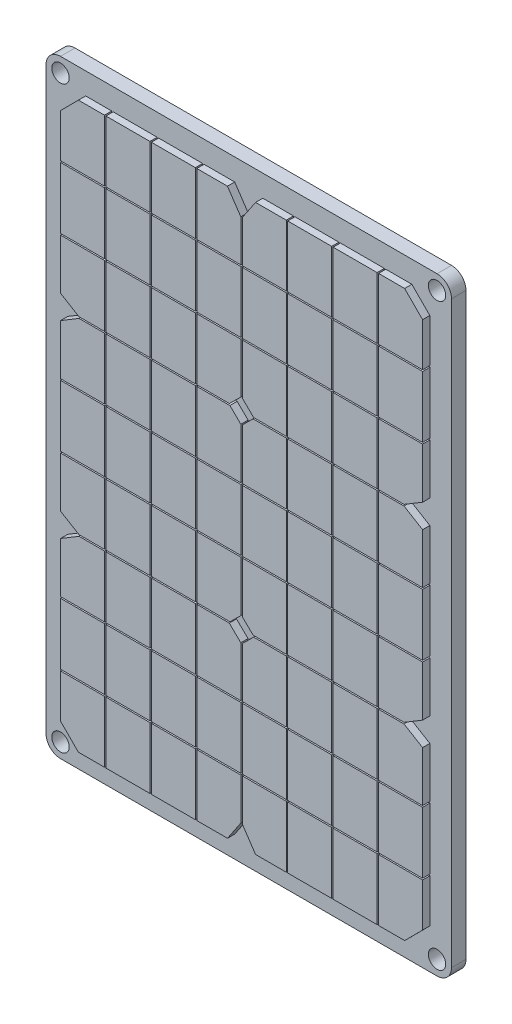
from build123d import *

# Parameters (mm, degrees)
SKETCH1_W                  = 280
SKETCH1_H                  = 420
BOSS_EXTRUDE1_DEPTH        = 10
SKETCH3_W                  = 30.375
SKETCH3_H                  = 42.44
BOSS_EXTRUDE2_DEPTH        = 5
LPATTERN1_COUNT            = 8
LPATTERN1_PITCH            = 31.38
LPATTERN2_COPY_1_SKETCH_W  = 30.375
LPATTERN2_COPY_1_SKETCH_H  = 42.44
LPATTERN2_COPY_1_DEPTH     = 5
LPATTERN2_COPY_2_SKETCH_W  = 30.375
LPATTERN2_COPY_2_SKETCH_H  = 42.44
LPATTERN2_COPY_2_DEPTH     = 5
LPATTERN2_COPY_3_SKETCH_W  = 30.375
LPATTERN2_COPY_3_SKETCH_H  = 42.44
LPATTERN2_COPY_3_DEPTH     = 5
LPATTERN2_COPY_4_SKETCH_W  = 30.375
LPATTERN2_COPY_4_SKETCH_H  = 42.44
LPATTERN2_COPY_4_DEPTH     = 5
LPATTERN2_COPY_5_SKETCH_W  = 30.375
LPATTERN2_COPY_5_SKETCH_H  = 42.44
LPATTERN2_COPY_5_DEPTH     = 5
LPATTERN2_COPY_6_SKETCH_W  = 30.375
LPATTERN2_COPY_6_SKETCH_H  = 42.44
LPATTERN2_COPY_6_DEPTH     = 5
LPATTERN2_COPY_7_SKETCH_W  = 30.375
LPATTERN2_COPY_7_SKETCH_H  = 42.44
LPATTERN2_COPY_7_DEPTH     = 5
LPATTERN2_COPY_8_SKETCH_W  = 30.375
LPATTERN2_COPY_8_SKETCH_H  = 42.44
LPATTERN2_COPY_8_DEPTH     = 5
LPATTERN2_COPY_9_SKETCH_W  = 30.375
LPATTERN2_COPY_9_SKETCH_H  = 42.44
LPATTERN2_COPY_9_DEPTH     = 5
LPATTERN2_COPY_10_SKETCH_W = 30.375
LPATTERN2_COPY_10_SKETCH_H = 42.44
LPATTERN2_COPY_10_DEPTH    = 5
LPATTERN2_COPY_11_SKETCH_W = 30.375
LPATTERN2_COPY_11_SKETCH_H = 42.44
LPATTERN2_COPY_11_DEPTH    = 5
LPATTERN2_COPY_12_SKETCH_W = 30.375
LPATTERN2_COPY_12_SKETCH_H = 42.44
LPATTERN2_COPY_12_DEPTH    = 5
LPATTERN2_COPY_13_SKETCH_W = 30.375
LPATTERN2_COPY_13_SKETCH_H = 42.44
LPATTERN2_COPY_13_DEPTH    = 5
LPATTERN2_COPY_14_SKETCH_W = 30.375
LPATTERN2_COPY_14_SKETCH_H = 42.44
LPATTERN2_COPY_14_DEPTH    = 5
LPATTERN2_COPY_15_SKETCH_W = 30.375
LPATTERN2_COPY_15_SKETCH_H = 42.44
LPATTERN2_COPY_15_DEPTH    = 5
LPATTERN2_COPY_16_SKETCH_W = 30.375
LPATTERN2_COPY_16_SKETCH_H = 42.44
LPATTERN2_COPY_16_DEPTH    = 5
LPATTERN2_COPY_17_SKETCH_W = 30.375
LPATTERN2_COPY_17_SKETCH_H = 42.44
LPATTERN2_COPY_17_DEPTH    = 5
LPATTERN2_COPY_18_SKETCH_W = 30.375
LPATTERN2_COPY_18_SKETCH_H = 42.44
LPATTERN2_COPY_18_DEPTH    = 5
LPATTERN2_COPY_19_SKETCH_W = 30.375
LPATTERN2_COPY_19_SKETCH_H = 42.44
LPATTERN2_COPY_19_DEPTH    = 5
LPATTERN2_COPY_20_SKETCH_W = 30.375
LPATTERN2_COPY_20_SKETCH_H = 42.44
LPATTERN2_COPY_20_DEPTH    = 5
LPATTERN2_COPY_21_SKETCH_W = 30.375
LPATTERN2_COPY_21_SKETCH_H = 42.44
LPATTERN2_COPY_21_DEPTH    = 5
LPATTERN2_COPY_22_SKETCH_W = 30.375
LPATTERN2_COPY_22_SKETCH_H = 42.44
LPATTERN2_COPY_22_DEPTH    = 5
LPATTERN2_COPY_23_SKETCH_W = 30.375
LPATTERN2_COPY_23_SKETCH_H = 42.44
LPATTERN2_COPY_23_DEPTH    = 5
LPATTERN2_COPY_24_SKETCH_W = 30.375
LPATTERN2_COPY_24_SKETCH_H = 42.44
LPATTERN2_COPY_24_DEPTH    = 5
LPATTERN2_COPY_25_SKETCH_W = 30.375
LPATTERN2_COPY_25_SKETCH_H = 42.44
LPATTERN2_COPY_25_DEPTH    = 5
LPATTERN2_COPY_26_SKETCH_W = 30.375
LPATTERN2_COPY_26_SKETCH_H = 42.44
LPATTERN2_COPY_26_DEPTH    = 5
LPATTERN2_COPY_27_SKETCH_W = 30.375
LPATTERN2_COPY_27_SKETCH_H = 42.44
LPATTERN2_COPY_27_DEPTH    = 5
LPATTERN2_COPY_28_SKETCH_W = 30.375
LPATTERN2_COPY_28_SKETCH_H = 42.44
LPATTERN2_COPY_28_DEPTH    = 5
LPATTERN2_COPY_29_SKETCH_W = 30.375
LPATTERN2_COPY_29_SKETCH_H = 42.44
LPATTERN2_COPY_29_DEPTH    = 5
LPATTERN2_COPY_30_SKETCH_W = 30.375
LPATTERN2_COPY_30_SKETCH_H = 42.44
LPATTERN2_COPY_30_DEPTH    = 5
LPATTERN2_COPY_31_SKETCH_W = 30.375
LPATTERN2_COPY_31_SKETCH_H = 42.44
LPATTERN2_COPY_31_DEPTH    = 5
LPATTERN2_COPY_32_SKETCH_W = 30.375
LPATTERN2_COPY_32_SKETCH_H = 42.44
LPATTERN2_COPY_32_DEPTH    = 5
LPATTERN2_COPY_33_SKETCH_W = 30.375
LPATTERN2_COPY_33_SKETCH_H = 42.44
LPATTERN2_COPY_33_DEPTH    = 5
LPATTERN2_COPY_34_SKETCH_W = 30.375
LPATTERN2_COPY_34_SKETCH_H = 42.44
LPATTERN2_COPY_34_DEPTH    = 5
LPATTERN2_COPY_35_SKETCH_W = 30.375
LPATTERN2_COPY_35_SKETCH_H = 42.44
LPATTERN2_COPY_35_DEPTH    = 5
LPATTERN2_COPY_36_SKETCH_W = 30.375
LPATTERN2_COPY_36_SKETCH_H = 42.44
LPATTERN2_COPY_36_DEPTH    = 5
LPATTERN2_COPY_37_SKETCH_W = 30.375
LPATTERN2_COPY_37_SKETCH_H = 42.44
LPATTERN2_COPY_37_DEPTH    = 5
LPATTERN2_COPY_38_SKETCH_W = 30.375
LPATTERN2_COPY_38_SKETCH_H = 42.44
LPATTERN2_COPY_38_DEPTH    = 5
LPATTERN2_COPY_39_SKETCH_W = 30.375
LPATTERN2_COPY_39_SKETCH_H = 42.44
LPATTERN2_COPY_39_DEPTH    = 5
LPATTERN2_COPY_40_SKETCH_W = 30.375
LPATTERN2_COPY_40_SKETCH_H = 42.44
LPATTERN2_COPY_40_DEPTH    = 5
LPATTERN2_COPY_41_SKETCH_W = 30.375
LPATTERN2_COPY_41_SKETCH_H = 42.44
LPATTERN2_COPY_41_DEPTH    = 5
LPATTERN2_COPY_42_SKETCH_W = 30.375
LPATTERN2_COPY_42_SKETCH_H = 42.44
LPATTERN2_COPY_42_DEPTH    = 5
LPATTERN2_COPY_43_SKETCH_W = 30.375
LPATTERN2_COPY_43_SKETCH_H = 42.44
LPATTERN2_COPY_43_DEPTH    = 5
LPATTERN2_COPY_44_SKETCH_W = 30.375
LPATTERN2_COPY_44_SKETCH_H = 42.44
LPATTERN2_COPY_44_DEPTH    = 5
LPATTERN2_COPY_45_SKETCH_W = 30.375
LPATTERN2_COPY_45_SKETCH_H = 42.44
LPATTERN2_COPY_45_DEPTH    = 5
LPATTERN2_COPY_46_SKETCH_W = 30.375
LPATTERN2_COPY_46_SKETCH_H = 42.44
LPATTERN2_COPY_46_DEPTH    = 5
LPATTERN2_COPY_47_SKETCH_W = 30.375
LPATTERN2_COPY_47_SKETCH_H = 42.44
LPATTERN2_COPY_47_DEPTH    = 5
LPATTERN2_COPY_48_SKETCH_W = 30.375
LPATTERN2_COPY_48_SKETCH_H = 42.44
LPATTERN2_COPY_48_DEPTH    = 5
LPATTERN2_COPY_49_SKETCH_W = 30.375
LPATTERN2_COPY_49_SKETCH_H = 42.44
LPATTERN2_COPY_49_DEPTH    = 5
LPATTERN2_COPY_50_SKETCH_W = 30.375
LPATTERN2_COPY_50_SKETCH_H = 42.44
LPATTERN2_COPY_50_DEPTH    = 5
LPATTERN2_COPY_51_SKETCH_W = 30.375
LPATTERN2_COPY_51_SKETCH_H = 42.44
LPATTERN2_COPY_51_DEPTH    = 5
LPATTERN2_COPY_52_SKETCH_W = 30.375
LPATTERN2_COPY_52_SKETCH_H = 42.44
LPATTERN2_COPY_52_DEPTH    = 5
LPATTERN2_COPY_53_SKETCH_W = 30.375
LPATTERN2_COPY_53_SKETCH_H = 42.44
LPATTERN2_COPY_53_DEPTH    = 5
LPATTERN2_COPY_54_SKETCH_W = 30.375
LPATTERN2_COPY_54_SKETCH_H = 42.44
LPATTERN2_COPY_54_DEPTH    = 5
LPATTERN2_COPY_55_SKETCH_W = 30.375
LPATTERN2_COPY_55_SKETCH_H = 42.44
LPATTERN2_COPY_55_DEPTH    = 5
LPATTERN2_COPY_56_SKETCH_W = 30.375
LPATTERN2_COPY_56_SKETCH_H = 42.44
LPATTERN2_COPY_56_DEPTH    = 5
LPATTERN2_COPY_57_SKETCH_W = 30.375
LPATTERN2_COPY_57_SKETCH_H = 42.44
LPATTERN2_COPY_57_DEPTH    = 5
LPATTERN2_COPY_58_SKETCH_W = 30.375
LPATTERN2_COPY_58_SKETCH_H = 42.44
LPATTERN2_COPY_58_DEPTH    = 5
LPATTERN2_COPY_59_SKETCH_W = 30.375
LPATTERN2_COPY_59_SKETCH_H = 42.44
LPATTERN2_COPY_59_DEPTH    = 5
LPATTERN2_COPY_60_SKETCH_W = 30.375
LPATTERN2_COPY_60_SKETCH_H = 42.44
LPATTERN2_COPY_60_DEPTH    = 5
LPATTERN2_COPY_61_SKETCH_W = 30.375
LPATTERN2_COPY_61_SKETCH_H = 42.44
LPATTERN2_COPY_61_DEPTH    = 5
LPATTERN2_COPY_62_SKETCH_W = 30.375
LPATTERN2_COPY_62_SKETCH_H = 42.44
LPATTERN2_COPY_62_DEPTH    = 5
LPATTERN2_COPY_63_SKETCH_W = 30.375
LPATTERN2_COPY_63_SKETCH_H = 42.44
LPATTERN2_COPY_63_DEPTH    = 5
LPATTERN2_COPY_64_SKETCH_W = 30.375
LPATTERN2_COPY_64_SKETCH_H = 42.44
LPATTERN2_COPY_64_DEPTH    = 5
FILLET1_R                  = 10
SKETCH4_R                  = 6
CUT_EXTRUDE1_DEPTH         = 253.586618806
MIRROR4_COPY_1_SKETCH_R    = 6
MIRROR4_COPY_1_DEPTH       = 253.586618806
CUT_EXTRUDE2_DEPTH         = 5
CUT_EXTRUDE3_DEPTH         = 5
CUT_EXTRUDE4_DEPTH         = 5
MIRROR8_COPY_1_DEPTH       = 5
CUT_EXTRUDE5_DEPTH         = 5
MIRROR11_COPY_1_DEPTH      = 5


with BuildPart() as part:
    # Sketch1 → Boss-Extrude1 (new body)
    with BuildSketch(Plane.XY):
        Rectangle(SKETCH1_W, SKETCH1_H)
    extrude(amount=BOSS_EXTRUDE1_DEPTH)

    # Sketch3 → Boss-Extrude2 (add)
    with BuildSketch(Plane.XY.offset(10)):
        with Locations((-109.8125, 173.78)):
            Rectangle(SKETCH3_W, SKETCH3_H)
    boss_extrude2 = extrude(amount=BOSS_EXTRUDE2_DEPTH)

    # LPattern1: Boss-Extrude2 ×8
    with Locations(*[(i * LPATTERN1_PITCH, 0, 0) for i in range(1, LPATTERN1_COUNT)]):
        add(boss_extrude2)

    # LPattern2 copy 1 sketch → LPattern2 copy 1 (add)
    with BuildSketch(Plane(origin=(31.38, -43.44, 10), x_dir=(1, 0, 0), z_dir=(0, 0, 1))):
        with Locations((-109.8125, 173.78)):
            Rectangle(LPATTERN2_COPY_1_SKETCH_W, LPATTERN2_COPY_1_SKETCH_H)
    extrude(amount=LPATTERN2_COPY_1_DEPTH)

    # LPattern2 copy 2 sketch → LPattern2 copy 2 (add)
    with BuildSketch(Plane(origin=(31.38, -86.88, 10), x_dir=(1, 0, 0), z_dir=(0, 0, 1))):
        with Locations((-109.8125, 173.78)):
            Rectangle(LPATTERN2_COPY_2_SKETCH_W, LPATTERN2_COPY_2_SKETCH_H)
    extrude(amount=LPATTERN2_COPY_2_DEPTH)

    # LPattern2 copy 3 sketch → LPattern2 copy 3 (add)
    with BuildSketch(Plane(origin=(31.38, -130.32, 10), x_dir=(1, 0, 0), z_dir=(0, 0, 1))):
        with Locations((-109.8125, 173.78)):
            Rectangle(LPATTERN2_COPY_3_SKETCH_W, LPATTERN2_COPY_3_SKETCH_H)
    extrude(amount=LPATTERN2_COPY_3_DEPTH)

    # LPattern2 copy 4 sketch → LPattern2 copy 4 (add)
    with BuildSketch(Plane(origin=(31.38, -173.76, 10), x_dir=(1, 0, 0), z_dir=(0, 0, 1))):
        with Locations((-109.8125, 173.78)):
            Rectangle(LPATTERN2_COPY_4_SKETCH_W, LPATTERN2_COPY_4_SKETCH_H)
    extrude(amount=LPATTERN2_COPY_4_DEPTH)

    # LPattern2 copy 5 sketch → LPattern2 copy 5 (add)
    with BuildSketch(Plane(origin=(31.38, -217.2, 10), x_dir=(1, 0, 0), z_dir=(0, 0, 1))):
        with Locations((-109.8125, 173.78)):
            Rectangle(LPATTERN2_COPY_5_SKETCH_W, LPATTERN2_COPY_5_SKETCH_H)
    extrude(amount=LPATTERN2_COPY_5_DEPTH)

    # LPattern2 copy 6 sketch → LPattern2 copy 6 (add)
    with BuildSketch(Plane(origin=(31.38, -260.64, 10), x_dir=(1, 0, 0), z_dir=(0, 0, 1))):
        with Locations((-109.8125, 173.78)):
            Rectangle(LPATTERN2_COPY_6_SKETCH_W, LPATTERN2_COPY_6_SKETCH_H)
    extrude(amount=LPATTERN2_COPY_6_DEPTH)

    # LPattern2 copy 7 sketch → LPattern2 copy 7 (add)
    with BuildSketch(Plane(origin=(31.38, -304.08, 10), x_dir=(1, 0, 0), z_dir=(0, 0, 1))):
        with Locations((-109.8125, 173.78)):
            Rectangle(LPATTERN2_COPY_7_SKETCH_W, LPATTERN2_COPY_7_SKETCH_H)
    extrude(amount=LPATTERN2_COPY_7_DEPTH)

    # LPattern2 copy 8 sketch → LPattern2 copy 8 (add)
    with BuildSketch(Plane(origin=(31.38, -347.52, 10), x_dir=(1, 0, 0), z_dir=(0, 0, 1))):
        with Locations((-109.8125, 173.78)):
            Rectangle(LPATTERN2_COPY_8_SKETCH_W, LPATTERN2_COPY_8_SKETCH_H)
    extrude(amount=LPATTERN2_COPY_8_DEPTH)

    # LPattern2 copy 9 sketch → LPattern2 copy 9 (add)
    with BuildSketch(Plane(origin=(62.76, -43.44, 10), x_dir=(1, 0, 0), z_dir=(0, 0, 1))):
        with Locations((-109.8125, 173.78)):
            Rectangle(LPATTERN2_COPY_9_SKETCH_W, LPATTERN2_COPY_9_SKETCH_H)
    extrude(amount=LPATTERN2_COPY_9_DEPTH)

    # LPattern2 copy 10 sketch → LPattern2 copy 10 (add)
    with BuildSketch(Plane(origin=(62.76, -86.88, 10), x_dir=(1, 0, 0), z_dir=(0, 0, 1))):
        with Locations((-109.8125, 173.78)):
            Rectangle(LPATTERN2_COPY_10_SKETCH_W, LPATTERN2_COPY_10_SKETCH_H)
    extrude(amount=LPATTERN2_COPY_10_DEPTH)

    # LPattern2 copy 11 sketch → LPattern2 copy 11 (add)
    with BuildSketch(Plane(origin=(62.76, -130.32, 10), x_dir=(1, 0, 0), z_dir=(0, 0, 1))):
        with Locations((-109.8125, 173.78)):
            Rectangle(LPATTERN2_COPY_11_SKETCH_W, LPATTERN2_COPY_11_SKETCH_H)
    extrude(amount=LPATTERN2_COPY_11_DEPTH)

    # LPattern2 copy 12 sketch → LPattern2 copy 12 (add)
    with BuildSketch(Plane(origin=(62.76, -173.76, 10), x_dir=(1, 0, 0), z_dir=(0, 0, 1))):
        with Locations((-109.8125, 173.78)):
            Rectangle(LPATTERN2_COPY_12_SKETCH_W, LPATTERN2_COPY_12_SKETCH_H)
    extrude(amount=LPATTERN2_COPY_12_DEPTH)

    # LPattern2 copy 13 sketch → LPattern2 copy 13 (add)
    with BuildSketch(Plane(origin=(62.76, -217.2, 10), x_dir=(1, 0, 0), z_dir=(0, 0, 1))):
        with Locations((-109.8125, 173.78)):
            Rectangle(LPATTERN2_COPY_13_SKETCH_W, LPATTERN2_COPY_13_SKETCH_H)
    extrude(amount=LPATTERN2_COPY_13_DEPTH)

    # LPattern2 copy 14 sketch → LPattern2 copy 14 (add)
    with BuildSketch(Plane(origin=(62.76, -260.64, 10), x_dir=(1, 0, 0), z_dir=(0, 0, 1))):
        with Locations((-109.8125, 173.78)):
            Rectangle(LPATTERN2_COPY_14_SKETCH_W, LPATTERN2_COPY_14_SKETCH_H)
    extrude(amount=LPATTERN2_COPY_14_DEPTH)

    # LPattern2 copy 15 sketch → LPattern2 copy 15 (add)
    with BuildSketch(Plane(origin=(62.76, -304.08, 10), x_dir=(1, 0, 0), z_dir=(0, 0, 1))):
        with Locations((-109.8125, 173.78)):
            Rectangle(LPATTERN2_COPY_15_SKETCH_W, LPATTERN2_COPY_15_SKETCH_H)
    extrude(amount=LPATTERN2_COPY_15_DEPTH)

    # LPattern2 copy 16 sketch → LPattern2 copy 16 (add)
    with BuildSketch(Plane(origin=(62.76, -347.52, 10), x_dir=(1, 0, 0), z_dir=(0, 0, 1))):
        with Locations((-109.8125, 173.78)):
            Rectangle(LPATTERN2_COPY_16_SKETCH_W, LPATTERN2_COPY_16_SKETCH_H)
    extrude(amount=LPATTERN2_COPY_16_DEPTH)

    # LPattern2 copy 17 sketch → LPattern2 copy 17 (add)
    with BuildSketch(Plane(origin=(94.14, -43.44, 10), x_dir=(1, 0, 0), z_dir=(0, 0, 1))):
        with Locations((-109.8125, 173.78)):
            Rectangle(LPATTERN2_COPY_17_SKETCH_W, LPATTERN2_COPY_17_SKETCH_H)
    extrude(amount=LPATTERN2_COPY_17_DEPTH)

    # LPattern2 copy 18 sketch → LPattern2 copy 18 (add)
    with BuildSketch(Plane(origin=(94.14, -86.88, 10), x_dir=(1, 0, 0), z_dir=(0, 0, 1))):
        with Locations((-109.8125, 173.78)):
            Rectangle(LPATTERN2_COPY_18_SKETCH_W, LPATTERN2_COPY_18_SKETCH_H)
    extrude(amount=LPATTERN2_COPY_18_DEPTH)

    # LPattern2 copy 19 sketch → LPattern2 copy 19 (add)
    with BuildSketch(Plane(origin=(94.14, -130.32, 10), x_dir=(1, 0, 0), z_dir=(0, 0, 1))):
        with Locations((-109.8125, 173.78)):
            Rectangle(LPATTERN2_COPY_19_SKETCH_W, LPATTERN2_COPY_19_SKETCH_H)
    extrude(amount=LPATTERN2_COPY_19_DEPTH)

    # LPattern2 copy 20 sketch → LPattern2 copy 20 (add)
    with BuildSketch(Plane(origin=(94.14, -173.76, 10), x_dir=(1, 0, 0), z_dir=(0, 0, 1))):
        with Locations((-109.8125, 173.78)):
            Rectangle(LPATTERN2_COPY_20_SKETCH_W, LPATTERN2_COPY_20_SKETCH_H)
    extrude(amount=LPATTERN2_COPY_20_DEPTH)

    # LPattern2 copy 21 sketch → LPattern2 copy 21 (add)
    with BuildSketch(Plane(origin=(94.14, -217.2, 10), x_dir=(1, 0, 0), z_dir=(0, 0, 1))):
        with Locations((-109.8125, 173.78)):
            Rectangle(LPATTERN2_COPY_21_SKETCH_W, LPATTERN2_COPY_21_SKETCH_H)
    extrude(amount=LPATTERN2_COPY_21_DEPTH)

    # LPattern2 copy 22 sketch → LPattern2 copy 22 (add)
    with BuildSketch(Plane(origin=(94.14, -260.64, 10), x_dir=(1, 0, 0), z_dir=(0, 0, 1))):
        with Locations((-109.8125, 173.78)):
            Rectangle(LPATTERN2_COPY_22_SKETCH_W, LPATTERN2_COPY_22_SKETCH_H)
    extrude(amount=LPATTERN2_COPY_22_DEPTH)

    # LPattern2 copy 23 sketch → LPattern2 copy 23 (add)
    with BuildSketch(Plane(origin=(94.14, -304.08, 10), x_dir=(1, 0, 0), z_dir=(0, 0, 1))):
        with Locations((-109.8125, 173.78)):
            Rectangle(LPATTERN2_COPY_23_SKETCH_W, LPATTERN2_COPY_23_SKETCH_H)
    extrude(amount=LPATTERN2_COPY_23_DEPTH)

    # LPattern2 copy 24 sketch → LPattern2 copy 24 (add)
    with BuildSketch(Plane(origin=(94.14, -347.52, 10), x_dir=(1, 0, 0), z_dir=(0, 0, 1))):
        with Locations((-109.8125, 173.78)):
            Rectangle(LPATTERN2_COPY_24_SKETCH_W, LPATTERN2_COPY_24_SKETCH_H)
    extrude(amount=LPATTERN2_COPY_24_DEPTH)

    # LPattern2 copy 25 sketch → LPattern2 copy 25 (add)
    with BuildSketch(Plane(origin=(125.52, -43.44, 10), x_dir=(1, 0, 0), z_dir=(0, 0, 1))):
        with Locations((-109.8125, 173.78)):
            Rectangle(LPATTERN2_COPY_25_SKETCH_W, LPATTERN2_COPY_25_SKETCH_H)
    extrude(amount=LPATTERN2_COPY_25_DEPTH)

    # LPattern2 copy 26 sketch → LPattern2 copy 26 (add)
    with BuildSketch(Plane(origin=(125.52, -86.88, 10), x_dir=(1, 0, 0), z_dir=(0, 0, 1))):
        with Locations((-109.8125, 173.78)):
            Rectangle(LPATTERN2_COPY_26_SKETCH_W, LPATTERN2_COPY_26_SKETCH_H)
    extrude(amount=LPATTERN2_COPY_26_DEPTH)

    # LPattern2 copy 27 sketch → LPattern2 copy 27 (add)
    with BuildSketch(Plane(origin=(125.52, -130.32, 10), x_dir=(1, 0, 0), z_dir=(0, 0, 1))):
        with Locations((-109.8125, 173.78)):
            Rectangle(LPATTERN2_COPY_27_SKETCH_W, LPATTERN2_COPY_27_SKETCH_H)
    extrude(amount=LPATTERN2_COPY_27_DEPTH)

    # LPattern2 copy 28 sketch → LPattern2 copy 28 (add)
    with BuildSketch(Plane(origin=(125.52, -173.76, 10), x_dir=(1, 0, 0), z_dir=(0, 0, 1))):
        with Locations((-109.8125, 173.78)):
            Rectangle(LPATTERN2_COPY_28_SKETCH_W, LPATTERN2_COPY_28_SKETCH_H)
    extrude(amount=LPATTERN2_COPY_28_DEPTH)

    # LPattern2 copy 29 sketch → LPattern2 copy 29 (add)
    with BuildSketch(Plane(origin=(125.52, -217.2, 10), x_dir=(1, 0, 0), z_dir=(0, 0, 1))):
        with Locations((-109.8125, 173.78)):
            Rectangle(LPATTERN2_COPY_29_SKETCH_W, LPATTERN2_COPY_29_SKETCH_H)
    extrude(amount=LPATTERN2_COPY_29_DEPTH)

    # LPattern2 copy 30 sketch → LPattern2 copy 30 (add)
    with BuildSketch(Plane(origin=(125.52, -260.64, 10), x_dir=(1, 0, 0), z_dir=(0, 0, 1))):
        with Locations((-109.8125, 173.78)):
            Rectangle(LPATTERN2_COPY_30_SKETCH_W, LPATTERN2_COPY_30_SKETCH_H)
    extrude(amount=LPATTERN2_COPY_30_DEPTH)

    # LPattern2 copy 31 sketch → LPattern2 copy 31 (add)
    with BuildSketch(Plane(origin=(125.52, -304.08, 10), x_dir=(1, 0, 0), z_dir=(0, 0, 1))):
        with Locations((-109.8125, 173.78)):
            Rectangle(LPATTERN2_COPY_31_SKETCH_W, LPATTERN2_COPY_31_SKETCH_H)
    extrude(amount=LPATTERN2_COPY_31_DEPTH)

    # LPattern2 copy 32 sketch → LPattern2 copy 32 (add)
    with BuildSketch(Plane(origin=(125.52, -347.52, 10), x_dir=(1, 0, 0), z_dir=(0, 0, 1))):
        with Locations((-109.8125, 173.78)):
            Rectangle(LPATTERN2_COPY_32_SKETCH_W, LPATTERN2_COPY_32_SKETCH_H)
    extrude(amount=LPATTERN2_COPY_32_DEPTH)

    # LPattern2 copy 33 sketch → LPattern2 copy 33 (add)
    with BuildSketch(Plane(origin=(156.9, -43.44, 10), x_dir=(1, 0, 0), z_dir=(0, 0, 1))):
        with Locations((-109.8125, 173.78)):
            Rectangle(LPATTERN2_COPY_33_SKETCH_W, LPATTERN2_COPY_33_SKETCH_H)
    extrude(amount=LPATTERN2_COPY_33_DEPTH)

    # LPattern2 copy 34 sketch → LPattern2 copy 34 (add)
    with BuildSketch(Plane(origin=(156.9, -86.88, 10), x_dir=(1, 0, 0), z_dir=(0, 0, 1))):
        with Locations((-109.8125, 173.78)):
            Rectangle(LPATTERN2_COPY_34_SKETCH_W, LPATTERN2_COPY_34_SKETCH_H)
    extrude(amount=LPATTERN2_COPY_34_DEPTH)

    # LPattern2 copy 35 sketch → LPattern2 copy 35 (add)
    with BuildSketch(Plane(origin=(156.9, -130.32, 10), x_dir=(1, 0, 0), z_dir=(0, 0, 1))):
        with Locations((-109.8125, 173.78)):
            Rectangle(LPATTERN2_COPY_35_SKETCH_W, LPATTERN2_COPY_35_SKETCH_H)
    extrude(amount=LPATTERN2_COPY_35_DEPTH)

    # LPattern2 copy 36 sketch → LPattern2 copy 36 (add)
    with BuildSketch(Plane(origin=(156.9, -173.76, 10), x_dir=(1, 0, 0), z_dir=(0, 0, 1))):
        with Locations((-109.8125, 173.78)):
            Rectangle(LPATTERN2_COPY_36_SKETCH_W, LPATTERN2_COPY_36_SKETCH_H)
    extrude(amount=LPATTERN2_COPY_36_DEPTH)

    # LPattern2 copy 37 sketch → LPattern2 copy 37 (add)
    with BuildSketch(Plane(origin=(156.9, -217.2, 10), x_dir=(1, 0, 0), z_dir=(0, 0, 1))):
        with Locations((-109.8125, 173.78)):
            Rectangle(LPATTERN2_COPY_37_SKETCH_W, LPATTERN2_COPY_37_SKETCH_H)
    extrude(amount=LPATTERN2_COPY_37_DEPTH)

    # LPattern2 copy 38 sketch → LPattern2 copy 38 (add)
    with BuildSketch(Plane(origin=(156.9, -260.64, 10), x_dir=(1, 0, 0), z_dir=(0, 0, 1))):
        with Locations((-109.8125, 173.78)):
            Rectangle(LPATTERN2_COPY_38_SKETCH_W, LPATTERN2_COPY_38_SKETCH_H)
    extrude(amount=LPATTERN2_COPY_38_DEPTH)

    # LPattern2 copy 39 sketch → LPattern2 copy 39 (add)
    with BuildSketch(Plane(origin=(156.9, -304.08, 10), x_dir=(1, 0, 0), z_dir=(0, 0, 1))):
        with Locations((-109.8125, 173.78)):
            Rectangle(LPATTERN2_COPY_39_SKETCH_W, LPATTERN2_COPY_39_SKETCH_H)
    extrude(amount=LPATTERN2_COPY_39_DEPTH)

    # LPattern2 copy 40 sketch → LPattern2 copy 40 (add)
    with BuildSketch(Plane(origin=(156.9, -347.52, 10), x_dir=(1, 0, 0), z_dir=(0, 0, 1))):
        with Locations((-109.8125, 173.78)):
            Rectangle(LPATTERN2_COPY_40_SKETCH_W, LPATTERN2_COPY_40_SKETCH_H)
    extrude(amount=LPATTERN2_COPY_40_DEPTH)

    # LPattern2 copy 41 sketch → LPattern2 copy 41 (add)
    with BuildSketch(Plane(origin=(188.28, -43.44, 10), x_dir=(1, 0, 0), z_dir=(0, 0, 1))):
        with Locations((-109.8125, 173.78)):
            Rectangle(LPATTERN2_COPY_41_SKETCH_W, LPATTERN2_COPY_41_SKETCH_H)
    extrude(amount=LPATTERN2_COPY_41_DEPTH)

    # LPattern2 copy 42 sketch → LPattern2 copy 42 (add)
    with BuildSketch(Plane(origin=(188.28, -86.88, 10), x_dir=(1, 0, 0), z_dir=(0, 0, 1))):
        with Locations((-109.8125, 173.78)):
            Rectangle(LPATTERN2_COPY_42_SKETCH_W, LPATTERN2_COPY_42_SKETCH_H)
    extrude(amount=LPATTERN2_COPY_42_DEPTH)

    # LPattern2 copy 43 sketch → LPattern2 copy 43 (add)
    with BuildSketch(Plane(origin=(188.28, -130.32, 10), x_dir=(1, 0, 0), z_dir=(0, 0, 1))):
        with Locations((-109.8125, 173.78)):
            Rectangle(LPATTERN2_COPY_43_SKETCH_W, LPATTERN2_COPY_43_SKETCH_H)
    extrude(amount=LPATTERN2_COPY_43_DEPTH)

    # LPattern2 copy 44 sketch → LPattern2 copy 44 (add)
    with BuildSketch(Plane(origin=(188.28, -173.76, 10), x_dir=(1, 0, 0), z_dir=(0, 0, 1))):
        with Locations((-109.8125, 173.78)):
            Rectangle(LPATTERN2_COPY_44_SKETCH_W, LPATTERN2_COPY_44_SKETCH_H)
    extrude(amount=LPATTERN2_COPY_44_DEPTH)

    # LPattern2 copy 45 sketch → LPattern2 copy 45 (add)
    with BuildSketch(Plane(origin=(188.28, -217.2, 10), x_dir=(1, 0, 0), z_dir=(0, 0, 1))):
        with Locations((-109.8125, 173.78)):
            Rectangle(LPATTERN2_COPY_45_SKETCH_W, LPATTERN2_COPY_45_SKETCH_H)
    extrude(amount=LPATTERN2_COPY_45_DEPTH)

    # LPattern2 copy 46 sketch → LPattern2 copy 46 (add)
    with BuildSketch(Plane(origin=(188.28, -260.64, 10), x_dir=(1, 0, 0), z_dir=(0, 0, 1))):
        with Locations((-109.8125, 173.78)):
            Rectangle(LPATTERN2_COPY_46_SKETCH_W, LPATTERN2_COPY_46_SKETCH_H)
    extrude(amount=LPATTERN2_COPY_46_DEPTH)

    # LPattern2 copy 47 sketch → LPattern2 copy 47 (add)
    with BuildSketch(Plane(origin=(188.28, -304.08, 10), x_dir=(1, 0, 0), z_dir=(0, 0, 1))):
        with Locations((-109.8125, 173.78)):
            Rectangle(LPATTERN2_COPY_47_SKETCH_W, LPATTERN2_COPY_47_SKETCH_H)
    extrude(amount=LPATTERN2_COPY_47_DEPTH)

    # LPattern2 copy 48 sketch → LPattern2 copy 48 (add)
    with BuildSketch(Plane(origin=(188.28, -347.52, 10), x_dir=(1, 0, 0), z_dir=(0, 0, 1))):
        with Locations((-109.8125, 173.78)):
            Rectangle(LPATTERN2_COPY_48_SKETCH_W, LPATTERN2_COPY_48_SKETCH_H)
    extrude(amount=LPATTERN2_COPY_48_DEPTH)

    # LPattern2 copy 49 sketch → LPattern2 copy 49 (add)
    with BuildSketch(Plane(origin=(219.66, -43.44, 10), x_dir=(1, 0, 0), z_dir=(0, 0, 1))):
        with Locations((-109.8125, 173.78)):
            Rectangle(LPATTERN2_COPY_49_SKETCH_W, LPATTERN2_COPY_49_SKETCH_H)
    extrude(amount=LPATTERN2_COPY_49_DEPTH)

    # LPattern2 copy 50 sketch → LPattern2 copy 50 (add)
    with BuildSketch(Plane(origin=(219.66, -86.88, 10), x_dir=(1, 0, 0), z_dir=(0, 0, 1))):
        with Locations((-109.8125, 173.78)):
            Rectangle(LPATTERN2_COPY_50_SKETCH_W, LPATTERN2_COPY_50_SKETCH_H)
    extrude(amount=LPATTERN2_COPY_50_DEPTH)

    # LPattern2 copy 51 sketch → LPattern2 copy 51 (add)
    with BuildSketch(Plane(origin=(219.66, -130.32, 10), x_dir=(1, 0, 0), z_dir=(0, 0, 1))):
        with Locations((-109.8125, 173.78)):
            Rectangle(LPATTERN2_COPY_51_SKETCH_W, LPATTERN2_COPY_51_SKETCH_H)
    extrude(amount=LPATTERN2_COPY_51_DEPTH)

    # LPattern2 copy 52 sketch → LPattern2 copy 52 (add)
    with BuildSketch(Plane(origin=(219.66, -173.76, 10), x_dir=(1, 0, 0), z_dir=(0, 0, 1))):
        with Locations((-109.8125, 173.78)):
            Rectangle(LPATTERN2_COPY_52_SKETCH_W, LPATTERN2_COPY_52_SKETCH_H)
    extrude(amount=LPATTERN2_COPY_52_DEPTH)

    # LPattern2 copy 53 sketch → LPattern2 copy 53 (add)
    with BuildSketch(Plane(origin=(219.66, -217.2, 10), x_dir=(1, 0, 0), z_dir=(0, 0, 1))):
        with Locations((-109.8125, 173.78)):
            Rectangle(LPATTERN2_COPY_53_SKETCH_W, LPATTERN2_COPY_53_SKETCH_H)
    extrude(amount=LPATTERN2_COPY_53_DEPTH)

    # LPattern2 copy 54 sketch → LPattern2 copy 54 (add)
    with BuildSketch(Plane(origin=(219.66, -260.64, 10), x_dir=(1, 0, 0), z_dir=(0, 0, 1))):
        with Locations((-109.8125, 173.78)):
            Rectangle(LPATTERN2_COPY_54_SKETCH_W, LPATTERN2_COPY_54_SKETCH_H)
    extrude(amount=LPATTERN2_COPY_54_DEPTH)

    # LPattern2 copy 55 sketch → LPattern2 copy 55 (add)
    with BuildSketch(Plane(origin=(219.66, -304.08, 10), x_dir=(1, 0, 0), z_dir=(0, 0, 1))):
        with Locations((-109.8125, 173.78)):
            Rectangle(LPATTERN2_COPY_55_SKETCH_W, LPATTERN2_COPY_55_SKETCH_H)
    extrude(amount=LPATTERN2_COPY_55_DEPTH)

    # LPattern2 copy 56 sketch → LPattern2 copy 56 (add)
    with BuildSketch(Plane(origin=(219.66, -347.52, 10), x_dir=(1, 0, 0), z_dir=(0, 0, 1))):
        with Locations((-109.8125, 173.78)):
            Rectangle(LPATTERN2_COPY_56_SKETCH_W, LPATTERN2_COPY_56_SKETCH_H)
    extrude(amount=LPATTERN2_COPY_56_DEPTH)

    # LPattern2 copy 57 sketch → LPattern2 copy 57 (add)
    with BuildSketch(Plane(origin=(0, -43.44, 10), x_dir=(1, 0, 0), z_dir=(0, 0, 1))):
        with Locations((-109.8125, 173.78)):
            Rectangle(LPATTERN2_COPY_57_SKETCH_W, LPATTERN2_COPY_57_SKETCH_H)
    extrude(amount=LPATTERN2_COPY_57_DEPTH)

    # LPattern2 copy 58 sketch → LPattern2 copy 58 (add)
    with BuildSketch(Plane(origin=(0, -86.88, 10), x_dir=(1, 0, 0), z_dir=(0, 0, 1))):
        with Locations((-109.8125, 173.78)):
            Rectangle(LPATTERN2_COPY_58_SKETCH_W, LPATTERN2_COPY_58_SKETCH_H)
    extrude(amount=LPATTERN2_COPY_58_DEPTH)

    # LPattern2 copy 59 sketch → LPattern2 copy 59 (add)
    with BuildSketch(Plane(origin=(0, -130.32, 10), x_dir=(1, 0, 0), z_dir=(0, 0, 1))):
        with Locations((-109.8125, 173.78)):
            Rectangle(LPATTERN2_COPY_59_SKETCH_W, LPATTERN2_COPY_59_SKETCH_H)
    extrude(amount=LPATTERN2_COPY_59_DEPTH)

    # LPattern2 copy 60 sketch → LPattern2 copy 60 (add)
    with BuildSketch(Plane(origin=(0, -173.76, 10), x_dir=(1, 0, 0), z_dir=(0, 0, 1))):
        with Locations((-109.8125, 173.78)):
            Rectangle(LPATTERN2_COPY_60_SKETCH_W, LPATTERN2_COPY_60_SKETCH_H)
    extrude(amount=LPATTERN2_COPY_60_DEPTH)

    # LPattern2 copy 61 sketch → LPattern2 copy 61 (add)
    with BuildSketch(Plane(origin=(0, -217.2, 10), x_dir=(1, 0, 0), z_dir=(0, 0, 1))):
        with Locations((-109.8125, 173.78)):
            Rectangle(LPATTERN2_COPY_61_SKETCH_W, LPATTERN2_COPY_61_SKETCH_H)
    extrude(amount=LPATTERN2_COPY_61_DEPTH)

    # LPattern2 copy 62 sketch → LPattern2 copy 62 (add)
    with BuildSketch(Plane(origin=(0, -260.64, 10), x_dir=(1, 0, 0), z_dir=(0, 0, 1))):
        with Locations((-109.8125, 173.78)):
            Rectangle(LPATTERN2_COPY_62_SKETCH_W, LPATTERN2_COPY_62_SKETCH_H)
    extrude(amount=LPATTERN2_COPY_62_DEPTH)

    # LPattern2 copy 63 sketch → LPattern2 copy 63 (add)
    with BuildSketch(Plane(origin=(0, -304.08, 10), x_dir=(1, 0, 0), z_dir=(0, 0, 1))):
        with Locations((-109.8125, 173.78)):
            Rectangle(LPATTERN2_COPY_63_SKETCH_W, LPATTERN2_COPY_63_SKETCH_H)
    extrude(amount=LPATTERN2_COPY_63_DEPTH)

    # LPattern2 copy 64 sketch → LPattern2 copy 64 (add)
    with BuildSketch(Plane(origin=(0, -347.52, 10), x_dir=(1, 0, 0), z_dir=(0, 0, 1))):
        with Locations((-109.8125, 173.78)):
            Rectangle(LPATTERN2_COPY_64_SKETCH_W, LPATTERN2_COPY_64_SKETCH_H)
    extrude(amount=LPATTERN2_COPY_64_DEPTH)

    # Fillet1
    fillet1_edges = [part.edges().sort_by_distance(p)[0] for p in [
        (-140, -210, 5),
        (-140, 210, 5),
        (140, 210, 5),
        (140, -210, 5),
    ]]
    fillet(fillet1_edges, radius=FILLET1_R)

    # Sketch4 → Cut-Extrude1 (cut, through all)
    with BuildSketch(Plane.XY.offset(10)):
        with Locations((-130, -200)):
            Circle(SKETCH4_R)
    cut_extrude1 = extrude(amount=-CUT_EXTRUDE1_DEPTH, mode=Mode.SUBTRACT)

    # Mirror2: Cut-Extrude1 across plane
    add(cut_extrude1.mirror(Plane(origin=(0, 0, 0), x_dir=(0, 0, 1), z_dir=(1, 0, 0))), mode=Mode.SUBTRACT)

    # Mirror4: Cut-Extrude1 across plane
    add(cut_extrude1.mirror(Plane.ZX), mode=Mode.SUBTRACT)

    # Mirror4 copy 1 sketch → Mirror4 copy 1 (cut, through all)
    with BuildSketch(Plane(origin=(0, 0, 10), x_dir=(-1, 0, 0), z_dir=(0, 0, 1))):
        with Locations((-130, -200)):
            Circle(MIRROR4_COPY_1_SKETCH_R)
    extrude(amount=-MIRROR4_COPY_1_DEPTH, mode=Mode.SUBTRACT)

    # Sketch6 → Cut-Extrude2 (cut)
    with BuildSketch(Plane.XY.offset(15)):
        Polygon((0, 73.92750897), (8.688881687, 65.34553193), (-0.031130511, 56.795187951), (-8.720012197, 65.377164991), align=None)
    cut_extrude2 = extrude(amount=-CUT_EXTRUDE2_DEPTH, mode=Mode.SUBTRACT)

    # Mirror5: Cut-Extrude2 across plane
    add(cut_extrude2.mirror(Plane.ZX), mode=Mode.SUBTRACT)

    # Sketch7 → Cut-Extrude3 (cut)
    with BuildSketch(Plane.XY.offset(15)):
        Polygon((-9.713129691, 195), (0, 180.569571572), (9.713129691, 195), align=None)
    cut_extrude3 = extrude(amount=-CUT_EXTRUDE3_DEPTH, mode=Mode.SUBTRACT)

    # Mirror6: Cut-Extrude3 across plane
    add(cut_extrude3.mirror(Plane.ZX), mode=Mode.SUBTRACT)

    # Sketch8 → Cut-Extrude4 (cut)
    with BuildSketch(Plane.XY.offset(15)):
        Polygon((125.035, 73.37089205), (111.390347677, 65.160932914), (125.035, 56.950973778), align=None)
    cut_extrude4 = extrude(amount=-CUT_EXTRUDE4_DEPTH, mode=Mode.SUBTRACT)

    # Mirror7: Cut-Extrude4 across plane
    add(cut_extrude4.mirror(Plane(origin=(0, 0, 0), x_dir=(0, 0, 1), z_dir=(1, 0, 0))), mode=Mode.SUBTRACT)

    # Mirror8: Cut-Extrude4 across plane
    add(cut_extrude4.mirror(Plane.ZX), mode=Mode.SUBTRACT)

    # Mirror8 copy 1 sketch → Mirror8 copy 1 (cut)
    with BuildSketch(Plane(origin=(0, 0, 15), x_dir=(-1, 0, 0), z_dir=(0, 0, 1))):
        Polygon((125.035, 73.37089205), (111.390347677, 65.160932914), (125.035, 56.950973778), align=None)
    extrude(amount=-MIRROR8_COPY_1_DEPTH, mode=Mode.SUBTRACT)

    # Sketch9 → Cut-Extrude5 (cut)
    with BuildSketch(Plane.XY.offset(15)):
        Polygon((-126.791879131, 180.758708979), (-112.625, 195), (-126.791879131, 195), align=None)
    cut_extrude5 = extrude(amount=-CUT_EXTRUDE5_DEPTH, mode=Mode.SUBTRACT)

    # Mirror10: Cut-Extrude5 across plane
    add(cut_extrude5.mirror(Plane(origin=(0, 0, 0), x_dir=(0, 0, 1), z_dir=(1, 0, 0))), mode=Mode.SUBTRACT)

    # Mirror11: Cut-Extrude5 across plane
    add(cut_extrude5.mirror(Plane.ZX), mode=Mode.SUBTRACT)

    # Mirror11 copy 1 sketch → Mirror11 copy 1 (cut)
    with BuildSketch(Plane(origin=(0, 0, 15), x_dir=(-1, 0, 0), z_dir=(0, 0, 1))):
        Polygon((-126.791879131, 180.758708979), (-112.625, 195), (-126.791879131, 195), align=None)
    extrude(amount=-MIRROR11_COPY_1_DEPTH, mode=Mode.SUBTRACT)


solid = part.part
